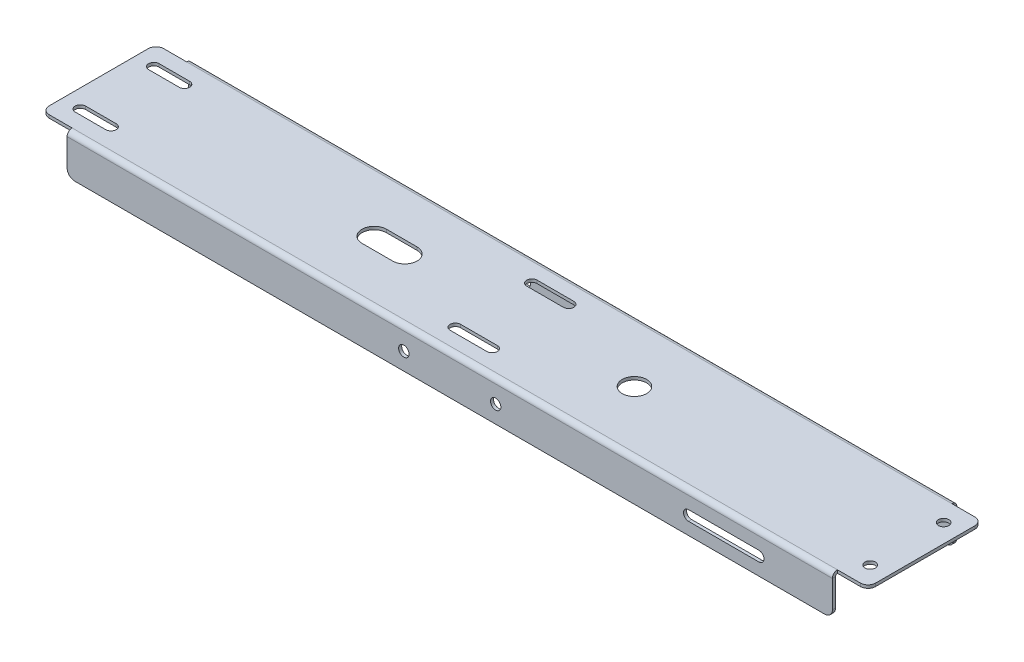
from build123d import *

# Parameters (mm, degrees)
SKETCH1_W               = 270
SKETCH1_H               = 37.4
BASE_FLANGE1_DEPTH      = 1
SKETCH4_R               = 4
CUT_EXTRUDE1_DEPTH      = 137.292663045
CUT_EXTRUDE2_DEPTH      = 1
EDGE_FLANGE1_DEPTH      = 250
EDGE_FLANGE1_BEND_DEPTH = 250
CUT_EXTRUDE3_REACH      = 139.14
SKETCH13_R              = 1.7
CUT_EXTRUDE4_DEPTH      = 142.591132844
BREAK_CORNER1_START     = -20.335
BREAK_CORNER1_DEPTH     = 40.67
BREAK_CORNER1_START_2   = -1
BREAK_CORNER1_2_DEPTH   = 1
CUT_EXTRUDE5_REACH      = 139.14
SKETCH16_R              = 1.7
CUT_EXTRUDE6_DEPTH      = 142.591132844
CUT_EXTRUDE7_DEPTH      = 1


# Read off the part's stored shape, not the designer's step: Break-Corner1
# Sheet-metal steps are written as plain solids
with BuildPart() as part:
    # Sketch1 → Base-Flange1 (new body)
    with BuildSketch(Plane(origin=(0, 0, 0), x_dir=(1, 0, 0), z_dir=(0, 1, 0))):
        Rectangle(SKETCH1_W, SKETCH1_H)
    extrude(amount=-BASE_FLANGE1_DEPTH)

    # Sketch4 → Cut-Extrude1 (cut, through all)
    with BuildSketch(Plane(origin=(0, 0, 0), x_dir=(1, 0, 0), z_dir=(0, 1, 0))):
        with Locations(Location((-40, 0, 0), (0, 0, 270))):
            Circle(SKETCH4_R)
        with Locations(Location((40, 0, 0), (0, 0, 90))):
            Circle(SKETCH4_R)
    extrude(amount=-CUT_EXTRUDE1_DEPTH, mode=Mode.SUBTRACT)

    # Sketch6 → Cut-Extrude2 (cut)
    with BuildSketch(Plane(origin=(0, 0, 0), x_dir=(1, 0, 0), z_dir=(0, 1, 0))):
        with BuildLine():
            Line((-45, 4), (-35, 4))
            ThreePointArc((-35, 4), (-31, 0), (-35, -4))
            Line((-35, -4), (-45, -4))
            ThreePointArc((-45, -4), (-49, 0), (-45, 4))
        make_face()
    extrude(amount=-CUT_EXTRUDE2_DEPTH, mode=Mode.SUBTRACT)

    # Edge-Flange1 section (across the edge) → Edge-Flange1 (add)
    with BuildSketch(Plane(origin=(125, -1, 19.335), x_dir=(0, 0, -1), z_dir=(-1, 0, 0))):
        with BuildLine():
            Line((-1, 0.635), (-1, 12))
            Line((-1, 12), (0, 12))
            Line((0, 12), (0, 0.635))
            ThreePointArc((0, 0.635), (0.185987194, 0.185987194), (0.635, 0))
            Line((0.635, 0), (0.635, -1))
            ThreePointArc((0.635, -1), (-0.521119587, -0.521119587), (-1, 0.635))
        make_face()
    extrude(amount=EDGE_FLANGE1_DEPTH)

    # Edge-Flange1 section 2 (across the edge) → Edge-Flange1 bend (add)
    with BuildSketch(Plane(origin=(-125, -1, -19.335), x_dir=(0, 0, 1), z_dir=(1, 0, 0))):
        with BuildLine():
            Line((-1, 0.635), (-1, 12))
            Line((-1, 12), (0, 12))
            Line((0, 12), (0, 0.635))
            ThreePointArc((0, 0.635), (0.185987194, 0.185987194), (0.635, 0))
            Line((0.635, 0), (0.635, -1))
            ThreePointArc((0.635, -1), (-0.521119587, -0.521119587), (-1, 0.635))
        make_face()
    extrude(amount=EDGE_FLANGE1_BEND_DEPTH)

    # Sketch13 → Cut-Extrude3 (cut, up to next)
    with BuildSketch(Plane(origin=(0, 0, 0), x_dir=(1, 0, 0), z_dir=(0, 1, 0)), mode=Mode.PRIVATE) as cut_extrude3_sk1:
        with Locations(Location((-129, 12, 0), (0, 0, 270))):
            Circle(SKETCH13_R)
    cut_extrude3_tool1 = extrude(cut_extrude3_sk1.sketch, amount=-CUT_EXTRUDE3_REACH, mode=Mode.PRIVATE) & part.part
    # Sketch13 → Cut-Extrude3 (cut, up to next)
    with BuildSketch(Plane(origin=(0, 0, 0), x_dir=(1, 0, 0), z_dir=(0, 1, 0)), mode=Mode.PRIVATE) as cut_extrude3_sk2:
        with Locations(Location((-129, -12, 0), (0, 0, 270))):
            Circle(SKETCH13_R)
    cut_extrude3_tool2 = extrude(cut_extrude3_sk2.sketch, amount=-CUT_EXTRUDE3_REACH, mode=Mode.PRIVATE) & part.part
    # Sketch13 → Cut-Extrude3 (cut, up to next)
    with BuildSketch(Plane(origin=(0, 0, 0), x_dir=(1, 0, 0), z_dir=(0, 1, 0)), mode=Mode.PRIVATE) as cut_extrude3_sk3:
        with Locations(Location((129, -12, 0), (0, 0, 270))):
            Circle(SKETCH13_R)
    cut_extrude3_tool3 = extrude(cut_extrude3_sk3.sketch, amount=-CUT_EXTRUDE3_REACH, mode=Mode.PRIVATE) & part.part
    # Sketch13 → Cut-Extrude3 (cut, up to next)
    with BuildSketch(Plane(origin=(0, 0, 0), x_dir=(1, 0, 0), z_dir=(0, 1, 0)), mode=Mode.PRIVATE) as cut_extrude3_sk4:
        with Locations(Location((129, 12, 0), (0, 0, 270))):
            Circle(SKETCH13_R)
    cut_extrude3_tool4 = extrude(cut_extrude3_sk4.sketch, amount=-CUT_EXTRUDE3_REACH, mode=Mode.PRIVATE) & part.part
    add(cut_extrude3_tool1.solids().sort_by_distance((-129, 0, -12))[0], mode=Mode.SUBTRACT)
    add(cut_extrude3_tool2.solids().sort_by_distance((-129, 0, 12))[0], mode=Mode.SUBTRACT)
    add(cut_extrude3_tool3.solids().sort_by_distance((129, 0, 12))[0], mode=Mode.SUBTRACT)
    add(cut_extrude3_tool4.solids().sort_by_distance((129, 0, -12))[0], mode=Mode.SUBTRACT)

    # Sketch14 → Cut-Extrude4 (cut, through all)
    with BuildSketch(Plane.XY.offset(20.335)):
        with BuildLine():
            Line((78, -5.6675), (101, -5.6675))
            ThreePointArc((101, -5.6675), (102.65, -7.3175), (101, -8.9675))
            Line((101, -8.9675), (78, -8.9675))
            ThreePointArc((78, -8.9675), (76.35, -7.3175), (78, -5.6675))
        make_face()
    extrude(amount=-CUT_EXTRUDE4_DEPTH, mode=Mode.SUBTRACT)

    # Break-Corner1 outline → Break-Corner1 (cut)
    with BuildSketch(Plane.XY.offset(BREAK_CORNER1_START)):
        with BuildLine():
            Line((-125, -13), (-122.5, -13))
            ThreePointArc((-122.5, -13), (-124.267766953, -12.267766953), (-125, -10.5))
            Line((-125, -10.5), (-125, -13))
        make_face()
        with BuildLine():
            ThreePointArc((125, -10.5), (124.267766953, -12.267766953), (122.5, -13))
            Line((122.5, -13), (125, -13))
            Line((125, -13), (125, -10.5))
        make_face()
    extrude(amount=BREAK_CORNER1_DEPTH, mode=Mode.SUBTRACT)

    # Break-Corner1 2 outline → Break-Corner1 2 (cut)
    with BuildSketch(Plane(origin=(0, 0, 0), x_dir=(1, 0, 0), z_dir=(0, 1, 0)).offset(BREAK_CORNER1_START_2)):
        with BuildLine():
            ThreePointArc((132.5, 18.7), (134.267766953, 17.967766953), (135, 16.2))
            Line((135, 16.2), (135, 18.7))
            Line((135, 18.7), (132.5, 18.7))
        make_face()
        with BuildLine():
            ThreePointArc((135, -16.2), (134.267766953, -17.967766953), (132.5, -18.7))
            Line((132.5, -18.7), (135, -18.7))
            Line((135, -18.7), (135, -16.2))
        make_face()
        with BuildLine():
            Line((-135, 18.7), (-135, 16.2))
            ThreePointArc((-135, 16.2), (-134.267766953, 17.967766953), (-132.5, 18.7))
            Line((-132.5, 18.7), (-135, 18.7))
        make_face()
        with BuildLine():
            ThreePointArc((-132.5, -18.7), (-134.267766953, -17.967766953), (-135, -16.2))
            Line((-135, -16.2), (-135, -18.7))
            Line((-135, -18.7), (-132.5, -18.7))
        make_face()
    extrude(amount=BREAK_CORNER1_2_DEPTH, mode=Mode.SUBTRACT)

    # Sketch15 → Cut-Extrude5 (cut, up to next)
    with BuildSketch(Plane(origin=(0, 0, 0), x_dir=(1, 0, 0), z_dir=(0, 1, 0)), mode=Mode.PRIVATE) as cut_extrude5_sk1:
        with BuildLine():
            Line((-6, -10.8), (6, -10.8))
            ThreePointArc((6, -10.8), (7.7, -12.5), (6, -14.2))
            Line((6, -14.2), (-6, -14.2))
            ThreePointArc((-6, -14.2), (-7.7, -12.5), (-6, -10.8))
        make_face()
    cut_extrude5_tool1 = extrude(cut_extrude5_sk1.sketch, amount=-CUT_EXTRUDE5_REACH, mode=Mode.PRIVATE) & part.part
    # Sketch15 → Cut-Extrude5 (cut, up to next)
    with BuildSketch(Plane(origin=(0, 0, 0), x_dir=(1, 0, 0), z_dir=(0, 1, 0)), mode=Mode.PRIVATE) as cut_extrude5_sk2:
        with BuildLine():
            Line((-6, 10.8), (6, 10.8))
            ThreePointArc((6, 10.8), (7.7, 12.5), (6, 14.2))
            Line((6, 14.2), (-6, 14.2))
            ThreePointArc((-6, 14.2), (-7.7, 12.5), (-6, 10.8))
        make_face()
    cut_extrude5_tool2 = extrude(cut_extrude5_sk2.sketch, amount=-CUT_EXTRUDE5_REACH, mode=Mode.PRIVATE) & part.part
    add(cut_extrude5_tool1.solids().sort_by_distance((0, 0, 12.5))[0], mode=Mode.SUBTRACT)
    add(cut_extrude5_tool2.solids().sort_by_distance((0, 0, -12.5))[0], mode=Mode.SUBTRACT)

    # Sketch16 → Cut-Extrude6 (cut, through all)
    with BuildSketch(Plane.XY.offset(20.335)):
        with Locations(Location((15, -7.3175, 0), (0, 0, 270))):
            Circle(SKETCH16_R)
        with Locations(Location((-15, -7.3175, 0), (0, 0, 270))):
            Circle(SKETCH16_R)
    extrude(amount=-CUT_EXTRUDE6_DEPTH, mode=Mode.SUBTRACT)

    # Sketch17 → Cut-Extrude7 (cut)
    with BuildSketch(Plane(origin=(0, 0, 0), x_dir=(1, 0, 0), z_dir=(0, 1, 0))):
        with BuildLine():
            Line((-129, -10.3), (-119, -10.3))
            ThreePointArc((-119, -10.3), (-117.3, -12), (-119, -13.7))
            Line((-119, -13.7), (-129, -13.7))
            ThreePointArc((-129, -13.7), (-130.7, -12), (-129, -10.3))
        make_face()
        with BuildLine():
            Line((-129, 13.7), (-119, 13.7))
            ThreePointArc((-119, 13.7), (-117.3, 12), (-119, 10.3))
            Line((-119, 10.3), (-129, 10.3))
            ThreePointArc((-129, 10.3), (-130.7, 12), (-129, 13.7))
        make_face()
    extrude(amount=-CUT_EXTRUDE7_DEPTH, mode=Mode.SUBTRACT)


solid = part.part
